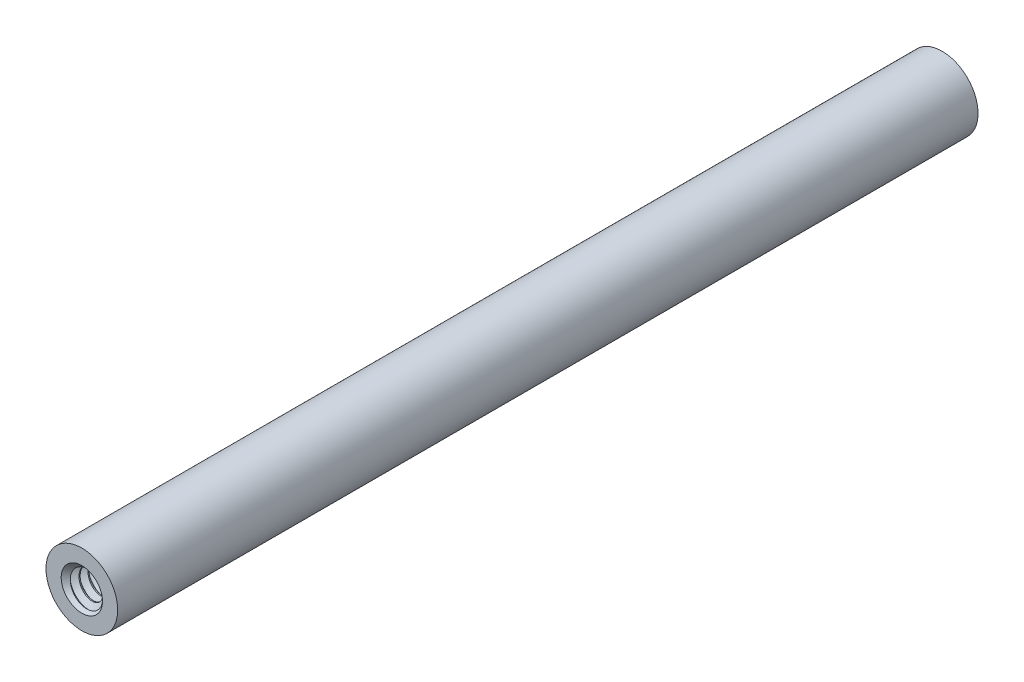
from build123d import *

# Parameters (mm, degrees)
BOSS_EXTRUDE1_START = 38.1
SKETCH13_R          = 1.7526
BOSS_EXTRUDE1_DEPTH = 9.525
CUT_SWEEP1_PITCH    = 0.79375
CIRPATTERN1_COUNT   = 2
CIRPATTERN1_ANGLE   = 180
EXTRUDE1_DEPTH      = 38.1
EXTRUDE1_DEPTH_BACK = 38.1
SKETCH1_R           = 3.175


with BuildPart() as part:
    # Sketch13 → Boss-Extrude1 (new body)
    with BuildSketch(Plane.XY.offset(BOSS_EXTRUDE1_START)):
        Circle(SKETCH13_R)
    extrude(amount=-BOSS_EXTRUDE1_DEPTH)

    # Cut-Sweep1: the profile of Sketch15 profile screwed along a right-hand helix of 13 turns, 8 arcs to a turn; built about Z, then put on its axis
    cut_sweep1_z = Axis((0, 0, 0), (0, 0, 1))
    cut_sweep1_corners = [(1.7529, 0, -0.694704455), (1.7529, 0, 0.000173205), (1.237044252, 0, -0.29765625), (1.237044252, 0, -0.396875)]
    with BuildLine(mode=Mode.PRIVATE) as cut_sweep1_profile:
        Line(cut_sweep1_corners[0], cut_sweep1_corners[1])
        Line(cut_sweep1_corners[1], cut_sweep1_corners[2])
        Line(cut_sweep1_corners[2], cut_sweep1_corners[3])
        Line(cut_sweep1_corners[3], cut_sweep1_corners[0])
    cut_sweep1_cap = Face(cut_sweep1_profile.wire())
    cut_sweep1_turn_angles = [0, 22.5, 45, 67.5, 90, 112.5, 135, 157.5, 180, 202.5, 225, 247.5, 270, 292.5, 315, 337.5, 360]
    cut_sweep1_turn_weights = [1, 0.9238795325112867, 1, 0.9238795325112867, 1, 0.9238795325112867, 1, 0.9238795325112867, 1, 0.9238795325112867, 1, 0.9238795325112867, 1, 0.9238795325112867, 1, 0.9238795325112867, 1]
    cut_sweep1_turn_rails = [Edge.make_bspline([Vector(p[0], p[1], 0).rotate(cut_sweep1_z, cut_sweep1_turn_angles[k]) / cut_sweep1_turn_weights[k] + Vector(0, 0, p[2] + CUT_SWEEP1_PITCH * cut_sweep1_turn_angles[k] / 360) for k in range(17)], [0, 0, 0, 1, 1, 2, 2, 3, 3, 4, 4, 5, 5, 6, 6, 7, 7, 8, 8, 8], 2, cut_sweep1_turn_weights) for p in cut_sweep1_corners]
    cut_sweep1_turn_sides = [Face.make_surface_from_curves(cut_sweep1_turn_rails[p[0]], cut_sweep1_turn_rails[p[1]]) for p in [(0, 1), (1, 2), (2, 3), (3, 0)]]
    cut_sweep1 = Plane(origin=(0, 0, 38.1), x_dir=(0, 1, 0), z_dir=(0, 0, -1)) * Solid(Shell([*[p.moved(Location((0, 0, CUT_SWEEP1_PITCH * i))) for i in range(13) for p in cut_sweep1_turn_sides], cut_sweep1_cap, cut_sweep1_cap.rotate(cut_sweep1_z, 4680).moved(Location((0, 0, CUT_SWEEP1_PITCH * 4680 / 360)))]))
    add(cut_sweep1, mode=Mode.SUBTRACT)

    # Boss-Extrude2 cone 1 section (through the dimple's axis) → Boss-Extrude2 (revolve)
    with BuildSketch(Plane(origin=(0, 0, 38.1), x_dir=(0, -1, 0), z_dir=(1, 0, 0))):
        Polygon((0, 0), (1.8288, 0), (0, 1.8288), align=None)
    revolve(axis=Axis((0, 0, 38.1), (0, 0, -1)))


with BuildPart() as cirpattern1_1:
    # CirPattern1: pattern copy
    add(part.part.rotate(Axis((0, 3.175, 0), (0, -1, 0)), 1 * CIRPATTERN1_ANGLE / (CIRPATTERN1_COUNT - 1)))


with BuildPart() as body_3:
    # Sketch1 → Extrude1 (new, two sides: drawn at the far end of the back side and taken through both)
    with BuildSketch(Plane.XY.offset(-EXTRUDE1_DEPTH_BACK)):
        with Locations(Location((0, 0, 0), (0, 0, 180))):
            Circle(SKETCH1_R)
    extrude(amount=EXTRUDE1_DEPTH + EXTRUDE1_DEPTH_BACK)

    # Combine1: cut CirPattern1_1, part
    add(cirpattern1_1.part, mode=Mode.SUBTRACT)
    add(part.part, mode=Mode.SUBTRACT)


solid = body_3.part
